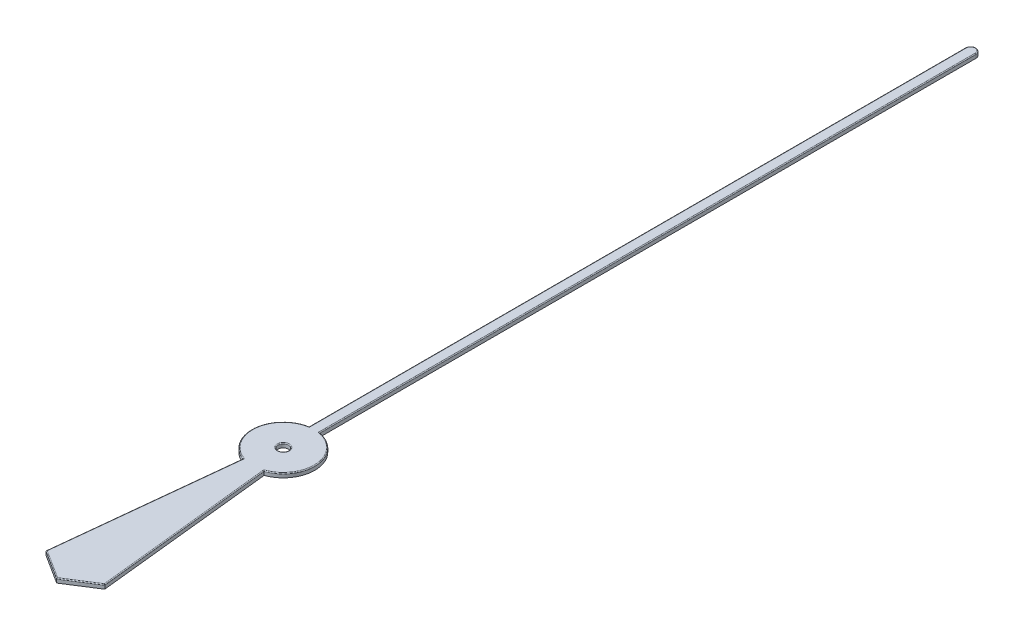
from build123d import *

# Parameters (mm, degrees)
SKETCH_3_R      = 0.125
EXTRUDE_1_DEPTH = 0.1
FILLET_1_R      = 0.125
FILLET_2_R      = 0.02


with BuildPart() as part:
    # 草图3 → 凸台-拉伸1 (new body)
    with BuildSketch(Plane(origin=(0, 0, 0), x_dir=(1, 0, 0), z_dir=(0, 1, 0))):
        with BuildLine():
            Line((0.125, 0.739509973), (0.125, 16.5))
            Line((0.125, 16.5), (-0.125, 16.5))
            Line((-0.125, 16.5), (-0.125, 0.739509973))
            ThreePointArc((-0.125, 0.739509973), (-0.747215671, 0.064565794), (-0.25, -0.707106781))
            Line((-0.25, -0.707106781), (-0.7, -4.954050817))
            Line((-0.7, -4.954050817), (0, -5.4))
            Line((0, -5.4), (0.7, -4.954050817))
            Line((0.7, -4.954050817), (0.25, -0.707106781))
            ThreePointArc((0.25, -0.707106781), (0.747215671, 0.064565794), (0.125, 0.739509973))
        make_face()
        with Locations(Location((0, 0, 0), (0, 0, 270))):
            Circle(SKETCH_3_R, mode=Mode.SUBTRACT)
    extrude(amount=EXTRUDE_1_DEPTH)

    # 圆角1
    fillet_1_edges = [part.edges().sort_by_distance(p)[0] for p in [
        (-0.125, 0.05, -16.5),
        (0.125, 0.05, -16.5),
    ]]
    fillet(fillet_1_edges, radius=FILLET_1_R - 0.0001)  # a hair under: the kernel refuses the full size

    # 圆角2
    fillet_2_edges = [part.edges().sort_by_distance(p)[0] for p in [
        (0.747215671, 0.1, -0.064565794),
        (0.125, 0.1, -8.557304986),
        (-0.747215671, 0.1, -0.064565794),
        (0, 0.1, -0.125),
        (-0.475, 0.1, 2.830578799),
        (-0.35, 0.1, 5.177025409),
        (-0.125, 0.1, -8.557304986),
        (0.088417637, 0.1, -16.463417637),
        (-0.088417637, 0.1, -16.463417637),
        (0.35, 0.1, 5.177025409),
        (0.475, 0.1, 2.830578799),
    ]]
    fillet(fillet_2_edges, radius=FILLET_2_R)


solid = part.part
